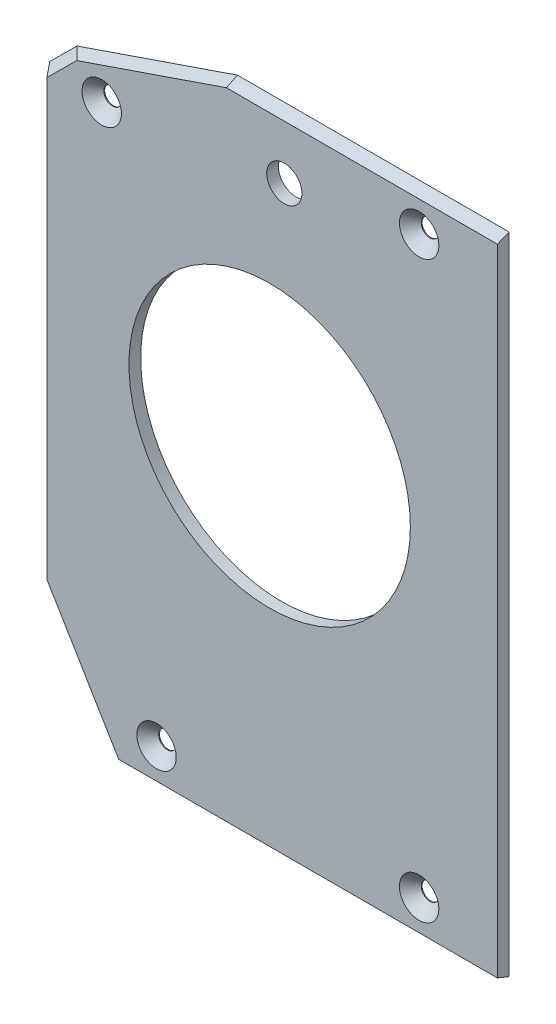
from build123d import *
from OCP.BRepFilletAPI import BRepFilletAPI_MakeChamfer

# Parameters (mm, degrees)
SKETCH1_R           = 24
BOSS_EXTRUDE1_DEPTH = 2
CHAMFER1_SIZE       = 2
CHAMFER1_SIZE_2     = 1.5
SKETCH3_R           = 3
SKETCH3_R_2         = 1.5
CUT_EXTRUDE1_DEPTH  = 2
CHAMFER2_SIZE       = 0.8
CHAMFER2_SIZE_2     = 2
CHAMFER3_SIZE       = 1.86


# Some blends are built 0.0001 mm under size
with BuildPart() as part:
    # Sketch1 → Boss-Extrude1 (new body)
    with BuildSketch(Plane.XY):
        Polygon((38.85, -60), (38.85, 50), (-7.5, 50), (-34.847350762, 40.623765453), (-39.5, 36.014047515), (-39.5, -39.169048105), (-27.001428863, -60), align=None)
        Circle(SKETCH1_R, mode=Mode.SUBTRACT)
    extrude(amount=BOSS_EXTRUDE1_DEPTH)

    # Chamfer1
    chamfer1_edges_1 = [part.edges().sort_by_distance(p)[0] for p in [
        (-39.5, -1.577500295, 2),
    ]]
    chamfer1_side_1 = [part.faces().sort_by_distance(p)[0] for p in [
        (-39.5, -1.577500295, 1.97),
    ]]
    chamfer1_edges_2 = [part.edges().sort_by_distance(p)[0] for p in [
        (-33.250714432, -49.584524053, 2),
    ]]
    chamfer1_side_2 = [part.faces().sort_by_distance(p)[0] for p in [
        (-33.250714432, -49.584524053, 1.97),
    ]]
    chamfer1_edges_3 = [part.edges().sort_by_distance(p)[0] for p in [
        (-37.173675381, 38.318906484, 2),
    ]]
    chamfer1_side_3 = [part.faces().sort_by_distance(p)[0] for p in [
        (-37.173675381, 38.318906484, 1.97),
    ]]
    chamfer1 = BRepFilletAPI_MakeChamfer(part.part.solid().wrapped)
    for e in chamfer1_edges_1:
        chamfer1.Add(CHAMFER1_SIZE - 0.0001, CHAMFER1_SIZE_2 - 0.0001, e.wrapped, chamfer1_side_1[0].wrapped)
    for e in chamfer1_edges_2:
        chamfer1.Add(CHAMFER1_SIZE - 0.0001, CHAMFER1_SIZE_2 - 0.0001, e.wrapped, chamfer1_side_2[0].wrapped)
    for e in chamfer1_edges_3:
        chamfer1.Add(CHAMFER1_SIZE - 0.0001, CHAMFER1_SIZE_2 - 0.0001, e.wrapped, chamfer1_side_3[0].wrapped)
    add(Compound.cast(chamfer1.Shape()), mode=Mode.REPLACE)  # a hair under: the kernel refuses the full size

    # Sketch3 → Cut-Extrude1 (cut)
    with BuildSketch(Plane.XY.offset(2)):
        with Locations((2.5, 40)):
            Circle(SKETCH3_R)
        with Locations((-19.291144984, -54)):
            Circle(SKETCH3_R_2)
        with Locations((25.5, -54)):
            Circle(SKETCH3_R_2)
        with Locations((25.5, 44)):
            Circle(SKETCH3_R_2)
        with Locations((-28.642921649, 36.408141149)):
            Circle(SKETCH3_R_2)
    extrude(amount=-CUT_EXTRUDE1_DEPTH, mode=Mode.SUBTRACT)

    # Chamfer2
    # the kernel refuses this chamfer: 2, 0.8 mm, written as the material it takes off along each edge
    with BuildSketch(Plane(origin=(-30.438487192, -60, 2), x_dir=(0, 0.996016754004022, 0.08916628142572558), z_dir=(1, 0, 0))) as chamfer2_piece_1:
        Polygon((CHAMFER2_SIZE * 0.996016754004, -CHAMFER2_SIZE * 0.0891662814257), (-CHAMFER2_SIZE_2 * 0.0891662814257, -CHAMFER2_SIZE_2 * 0.996016754004), (0, 0), align=None)
    extrude(amount=74.47471447, mode=Mode.SUBTRACT)
    with BuildSketch(Plane(origin=(44.036227278, 50, 2), x_dir=(0, -0.996016754004022, 0.08916628142572558), z_dir=(-1, 0, 0))) as chamfer2_piece_2:
        Polygon((CHAMFER2_SIZE * 0.996016754004, -CHAMFER2_SIZE * 0.0891662814257), (-CHAMFER2_SIZE_2 * 0.0891662814257, -CHAMFER2_SIZE_2 * 0.996016754004), (0, 0), align=None)
    extrude(amount=56.722454557, mode=Mode.SUBTRACT)
    with BuildSketch(Plane(origin=(-2.594109331, 51.682019658, 2), x_dir=(-0.0046450347702198845, 0.013548018079808006, -0.9998974321689664), z_dir=(-0.945945945945946, -0.3243243243243241, 0))) as chamfer2_piece_3:
        Polygon((CHAMFER2_SIZE_2 * 0.999897432169, CHAMFER2_SIZE_2 * 0.0143221905415), (-CHAMFER2_SIZE * 0.0143221905415, CHAMFER2_SIZE * 0.999897432169), (0, 0), align=None)
    extrude(amount=35.83751357, mode=Mode.SUBTRACT)

    # Chamfer3
    chamfer3_edges = [part.edges().sort_by_distance(p)[0] for p in [
        (-20.791144984, -54, 2),
        (24, -54, 2),
        (24, 44, 2),
        (-30.142921649, 36.408141149, 2),
    ]]
    chamfer(chamfer3_edges, length=CHAMFER3_SIZE)


solid = part.part
